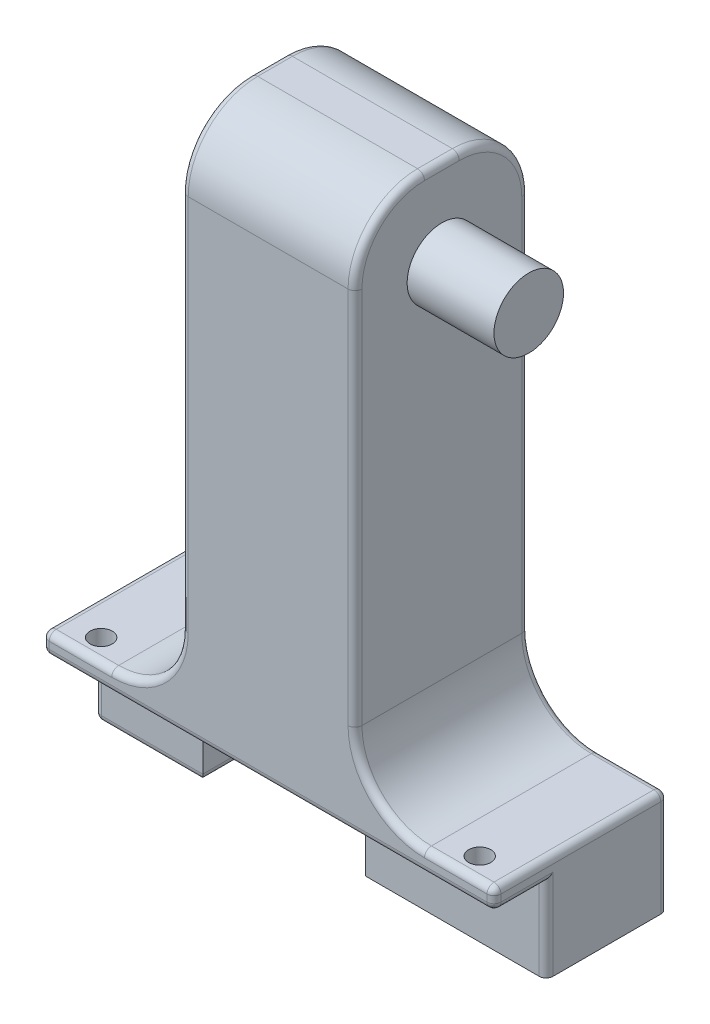
from build123d import *

# Parameters (mm, degrees)
SKETCH2_W           = 65
SKETCH2_H           = 25
BOSS_EXTRUDE1_DEPTH = 3
SKETCH3_W           = 15.6
SKETCH3_H           = 17.5
BOSS_EXTRUDE2_DEPTH = 12
SKETCH5_R           = 1.6
CUT_EXTRUDE1_DEPTH  = 38.91437722
SKETCH6_W           = 25
SKETCH6_H           = 25
BOSS_EXTRUDE3_DEPTH = 74.4
FILLET1_R           = 10
FILLET2_R           = 1
SKETCH9_R           = 5
BOSS_EXTRUDE4_DEPTH = 12.5


with BuildPart() as part:
    # Sketch2 → Boss-Extrude1 (new body)
    with BuildSketch(Plane(origin=(0, 0, 0), x_dir=(1, 0, 0), z_dir=(0, 1, 0))):
        Rectangle(SKETCH2_W, SKETCH2_H)
    extrude(amount=BOSS_EXTRUDE1_DEPTH)

    # Sketch3 → Boss-Extrude2 (add)
    with BuildSketch(Plane.XZ):
        with Locations((-24.7, -3.75)):
            Rectangle(SKETCH3_W, SKETCH3_H)
        Polygon((32.5, 5), (6.5, 5), (6.5, 0), (12.5, 0), (12.5, -12.5), (32.5, -12.5), align=None)
    extrude(amount=BOSS_EXTRUDE2_DEPTH)

    # Sketch5 → Cut-Extrude1 (cut, through all)
    with BuildSketch(Plane(origin=(0, 3, 0), x_dir=(1, 0, 0), z_dir=(0, 1, 0))):
        with Locations((27.234893969, -9.289666573)):
            Circle(SKETCH5_R)
        with Locations((-27.234893969, -9.289666573)):
            Circle(SKETCH5_R)
    extrude(amount=-CUT_EXTRUDE1_DEPTH, mode=Mode.SUBTRACT)

    # Sketch6 → Boss-Extrude3 (add)
    with BuildSketch(Plane(origin=(0, 3, 0), x_dir=(1, 0, 0), z_dir=(0, 1, 0))):
        Rectangle(SKETCH6_W, SKETCH6_H)
    extrude(amount=BOSS_EXTRUDE3_DEPTH)

    # Fillet1
    fillet1_edges = [part.edges().sort_by_distance(p)[0] for p in [
        (0, 77.4, 12.5),
        (0, 77.4, -12.5),
        (-12.5, 3, 0),
        (12.5, 3, 0),
    ]]
    fillet(fillet1_edges, radius=FILLET1_R)

    # Fillet2
    fillet2_edges = [part.edges().sort_by_distance(p)[0] for p in [
        (27.5, 3, 12.5),
        (15.428932188, 5.928932188, 12.5),
        (12.5, 40.2, 12.5),
        (12.5, 74.471067812, 9.571067812),
        (12.5, 77.4, 0),
        (12.5, 74.471067812, -9.571067812),
        (12.5, 40.2, -12.5),
        (15.428932188, 5.928932188, -12.5),
        (-27.5, 3, 12.5),
        (-15.428932188, 5.928932188, 12.5),
        (-12.5, 40.2, 12.5),
        (-12.5, 74.471067812, 9.571067812),
        (-12.5, 77.4, 0),
        (-12.5, 74.471067812, -9.571067812),
        (-27.5, 3, -12.5),
        (-15.428932188, 5.928932188, -12.5),
        (-24.7, -12, 5),
        (-16.9, -12, -3.75),
        (-24.7, -12, -12.5),
        (-32.5, -12, -3.75),
        (-32.5, 1.5, 12.5),
        (-32.5, -6, 5),
        (-32.5, 0, 8.75),
        (32.5, 1.5, 12.5),
        (32.5, -6, 5),
        (32.5, 0, 8.75),
        (0, 0, 12.5),
        (-32.5, -4.5, -12.5),
        (-32.5, 3, 0),
        (32.5, 3, 0),
        (32.5, -4.5, -12.5),
        (27.5, 3, -12.5),
        (-12.5, 40.2, -12.5),
    ]]
    fillet(fillet2_edges, radius=FILLET2_R)

    # Sketch9 → Boss-Extrude4 (add)
    with BuildSketch(Plane(origin=(12.5, 0, 0), x_dir=(0, 0, -1), z_dir=(1, 0, 0))):
        with Locations((0, 64.9)):
            Circle(SKETCH9_R)
    extrude(amount=BOSS_EXTRUDE4_DEPTH)


solid = part.part
